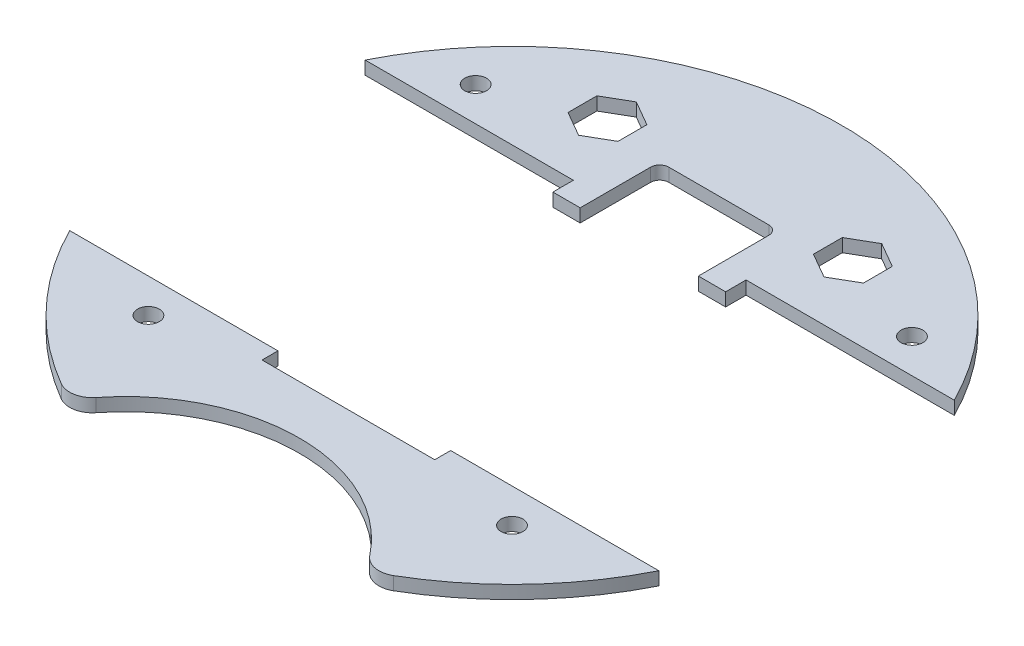
from build123d import *

# Parameters (mm, degrees)
BOSS_EXTRUDE1_DEPTH  = 2.9
SOLENOID_PLACEMENT_W = 38
SOLENOID_PLACEMENT_H = 64
CUT_EXTRUDE1_DEPTH   = 103.571487266
CUT_EXTRUDE4_DEPTH   = 103.571487266
CUT_EXTRUDE5_DEPTH   = 103.571487266
SKETCH6_R            = 2.4
CUT_EXTRUDE6_DEPTH   = 103.571487266
CUT_EXTRUDE3_DEPTH   = 103.571487266


with BuildPart() as part:
    # Sketch1 → Boss-Extrude1 (new body)
    with BuildSketch(Plane(origin=(0, 0, 0), x_dir=(1, 0, 0), z_dir=(0, 1, 0))):
        with BuildLine():
            ThreePointArc((36.543377003, -62.616544118), (0, 72.5), (-36.543377003, -62.616544118))
            ThreePointArc((-36.543377003, -62.616544118), (-33.085954668, -63.20954405), (-30.089832649, -61.38507948))
            ThreePointArc((-30.089832649, -61.38507948), (0, -46.75), (30.089832649, -61.38507948))
            ThreePointArc((30.089832649, -61.38507948), (33.085954668, -63.20954405), (36.543377003, -62.616544118))
        make_face()
    extrude(amount=BOSS_EXTRUDE1_DEPTH)

    # solenoid placement → Cut-Extrude1 (cut, through all)
    with BuildSketch(Plane(origin=(0, 2.9, 0), x_dir=(1, 0, 0), z_dir=(0, 1, 0))):
        with Locations((0, -4)):
            Rectangle(SOLENOID_PLACEMENT_W, SOLENOID_PLACEMENT_H)
    extrude(amount=-CUT_EXTRUDE1_DEPTH, mode=Mode.SUBTRACT)

    # Sketch4 → Cut-Extrude4 (cut, through all)
    with BuildSketch(Plane(origin=(0, 2.9, 0), x_dir=(1, 0, 0), z_dir=(0, 1, 0))):
        with BuildLine():
            Line((13, 28), (13, 43.5))
            ThreePointArc((13, 43.5), (12.414213562, 44.914213562), (11, 45.5))
            Line((11, 45.5), (-11, 45.5))
            ThreePointArc((-11, 45.5), (-12.414213562, 44.914213562), (-13, 43.5))
            Line((-13, 43.5), (-13, 28))
            Line((-13, 28), (13, 28))
        make_face()
    extrude(amount=-CUT_EXTRUDE4_DEPTH, mode=Mode.SUBTRACT)

    # Sketch5 → Cut-Extrude5 (cut, through all)
    with BuildSketch(Plane(origin=(0, 2.9, 0), x_dir=(1, 0, 0), z_dir=(0, 1, 0))):
        Polygon((-21.5, 51.175426481), (-27, 54.350852961), (-32.5, 51.175426481), (-32.5, 44.824573519), (-27, 41.649147039), (-21.5, 44.824573519), align=None)
        Polygon((21.5, 51.175426481), (21.5, 44.824573519), (27, 41.649147039), (32.5, 44.824573519), (32.5, 51.175426481), (27, 54.350852961), align=None)
    extrude(amount=-CUT_EXTRUDE5_DEPTH, mode=Mode.SUBTRACT)

    # Sketch6 → Cut-Extrude6 (cut, through all)
    with BuildSketch(Plane(origin=(0, 2.9, 0), x_dir=(1, 0, 0), z_dir=(0, 1, 0))):
        with Locations((40, -40)):
            Circle(SKETCH6_R)
        with Locations((-40, -40)):
            Circle(SKETCH6_R)
        with Locations((48, 40)):
            Circle(SKETCH6_R)
        with Locations((-48, 40)):
            Circle(SKETCH6_R)
    extrude(amount=-CUT_EXTRUDE6_DEPTH, mode=Mode.SUBTRACT)

    # Sketch3 → Cut-Extrude3 (cut, through all)
    with BuildSketch(Plane(origin=(0, 2.9, 0), x_dir=(1, 0, 0), z_dir=(0, 1, 0))):
        Polygon((-19, 28), (-19, 32.5), (-72.5, 32.5), (-72.5, -32.5), (72.5, -32.5), (72.5, 32.5), (19, 32.5), (19, 28), align=None)
    extrude(amount=-CUT_EXTRUDE3_DEPTH, mode=Mode.SUBTRACT)


with BuildPart() as cut_extrude3_piece_1:
    # of the separate pieces the step leaves, piece 1, a body of its own (cut_extrude3_pieces)
    add(part.part.solids().sort_by_distance((64.807406984, 0, -32.5))[0])


with BuildPart() as cut_extrude3_piece_2:
    # of the separate pieces the step leaves, piece 2, a body of its own (cut_extrude3_pieces)
    add(part.part.solids().sort_by_distance((-36.543377003, 0, 62.616544118))[0])


solid = Compound([cut_extrude3_piece_1.part, cut_extrude3_piece_2.part])
